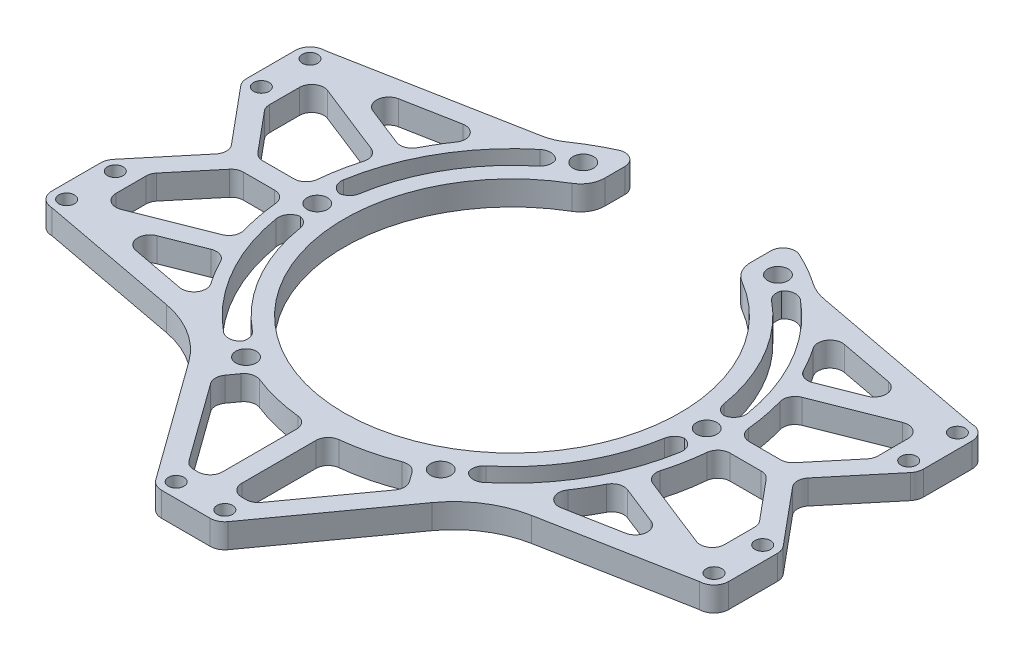
from build123d import *

# Parameters (mm, degrees)
SKETCH_1_R          = 2.1000000000001977
SKETCH_1_R_2        = 2.1000000000001293
SKETCH_1_R_3        = 2.100000000000071
SKETCH_1_R_4        = 2.1000000000002705
SKETCH_1_R_5        = 2.100000000000347
SKETCH_1_R_6        = 2.100000000000003
EXTRUDE_1_DEPTH     = 5
EXTRUDE_START       = -5
SKETCH_2_R          = 3.000000000000006
SKETCH_2_R_2        = 1.5999999999999908
SKETCH_2_R_3        = 2.9999999999999667
SKETCH_2_R_4        = 2.999999999999966
SKETCH_2_R_5        = 2.9999999999999933
SKETCH_2_R_6        = 2.999999999999979
SKETCH_2_R_7        = 2.9999999999999787
EXTRUDE_2_DEPTH     = 5
CUT_EXTRUDE_START   = -5
CUT_EXTRUDE_1_DEPTH = 5
FILLET_1_R          = 5
FILLET_2_R          = 2.5
FILLET_3_R          = 10
SKETCH_4_R          = 1.6000000000000003
SKETCH_4_R_2        = 1.5999999999999985
EXTRUDE_4_DEPTH     = 5
CUT_EXTRUDE_2_DEPTH = 5
FILLET_4_R          = 2.5
CUT_EXTRUDE_3_DEPTH = 5
FILLET_6_R          = 2.5
FILLET_8_R          = 20
FILLET_9_R          = 2.5


with BuildPart() as part:
    # 草图1 → 凸台-拉伸1 (new body)
    with BuildSketch(Plane(origin=(0, 0, 0), x_dir=(1, 0, 0), z_dir=(0, 1, 0))):
        with BuildLine():
            Line((-15.000000000000009, 31.068472765811965), (-15.000000000000009, 41.89570383702844))
            ThreePointArc((-15.000000000000012, 41.89570383702845), (-25.619816548913857, -36.385093101433725), (44.50000000000001, -1.09e-14))
            ThreePointArc((44.50000000000001, 0), (36.385093101433725, 25.619816548913857), (14.999999999999996, 41.89570383702846))
            Line((14.999999999999991, 41.89570383702845), (14.999999999999991, 31.06847276581198))
            ThreePointArc((14.999999999999986, 31.068472765811975), (29.22113960816723, 18.340528890956232), (34.5, 0))
            ThreePointArc((34.5, -8.45e-15), (-18.340528890956218, -29.221139608167242), (-15.000000000000009, 31.068472765811965))
        make_face()
        with Locations(Location((-20.000000000000036, -34.64101615137753, 0), (0, 0, 270))):
            Circle(SKETCH_1_R, mode=Mode.SUBTRACT)
        with Locations(Location((19.999999999999975, -34.64101615137757, 0), (0, 0, 270))):
            Circle(SKETCH_1_R_2, mode=Mode.SUBTRACT)
        with Locations(Location((40.000000000000014, -3.076e-14, 0), (0, 0, 270))):
            Circle(SKETCH_1_R_3, mode=Mode.SUBTRACT)
        with Locations(Location((-40.00000000000001, 2.547e-14, 0), (0, 0, 270))):
            Circle(SKETCH_1_R_4, mode=Mode.SUBTRACT)
        with Locations(Location((-19.999999999999993, 34.64101615137756, 0), (0, 0, 270))):
            Circle(SKETCH_1_R_5, mode=Mode.SUBTRACT)
        with Locations(Location((20.00000000000004, 34.64101615137753, 0), (0, 0, 270))):
            Circle(SKETCH_1_R_6, mode=Mode.SUBTRACT)
    extrude(amount=EXTRUDE_1_DEPTH)

    # 草图2 → 凸台-拉伸2 (add)
    # profile 1 of 16: a face of its own
    with BuildSketch(Plane(origin=(0, 5, 0), x_dir=(1, 0, 0), z_dir=(0, 1, 0)).offset(EXTRUDE_START)):
        with BuildLine():
            ThreePointArc((-34.19429924053646, 28.478059966378474), (-30.724288694148534, 32.191118095502944), (-26.853550976710252, 35.484317662049314))
            Line((-26.853550976710252, 35.484317662049314), (-66.5, 28.000000000000043))
            ThreePointArc((-66.5, 28.000000000000004), (-64.37867965644035, 27.121320343559642), (-63.49999999999999, 24.999999999999996))
            Line((-63.5, 25.000000000000036), (-63.5, 15.000000000000039))
            ThreePointArc((-63.49999999999999, 15), (-65.47914275483694, 12.179033767483535), (-68.80523365666541, 13.080130788783498))
            Line((-68.8052336566654, 13.080130788783507), (-57.91170001964725, 4.086e-14))
            Line((-57.91170001964725, 3.908e-14), (-34.19429924053647, 28.47805996637848))
        make_face()
    # profile 2 of 16: a face of its own
    with BuildSketch(Plane(origin=(0, 5, 0), x_dir=(1, 0, 0), z_dir=(0, 1, 0)).offset(EXTRUDE_START)):
        with BuildLine():
            ThreePointArc((-34.194299240536495, -28.478059966378414), (-44.5, 3.743e-14), (-34.19429924053646, 28.478059966378474))
            Line((-34.19429924053647, 28.47805996637848), (-57.91170001964725, 3.908e-14))
            Line((-57.91170001964725, 4.086e-14), (-34.194299240536495, -28.478059966378417))
        make_face()
    # profile 3 of 16: a face of its own
    with BuildSketch(Plane(origin=(0, 5, 0), x_dir=(1, 0, 0), z_dir=(0, 1, 0)).offset(EXTRUDE_START)):
        with BuildLine():
            Line((-66.5, -27.99999999999994), (-26.85355097671028, -35.48431766204926))
            ThreePointArc((-26.853550976710306, -35.48431766204924), (-30.724288694148584, -32.19111809550287), (-34.194299240536495, -28.478059966378414))
            Line((-34.194299240536495, -28.478059966378417), (-57.91170001964725, 4.086e-14))
            Line((-57.91170001964725, 3.908e-14), (-68.8052336566654, -13.080130788783409))
            ThreePointArc((-68.80523365666531, -13.080130788783476), (-65.47914275483691, -12.17903376748362), (-63.500000000000036, -15.00000000000003))
            ThreePointArc((-63.500000000000036, -15.00000000000003), (-66.5, -17.999999999999996), (-69.49999999999997, -15.00000000000003))
            Line((-69.5, -14.999999999999941), (-69.5, -24.99999999999994))
            ThreePointArc((-69.49999999999997, -25.000000000000032), (-66.5, -22.000000000000068), (-63.500000000000036, -25.000000000000032))
            ThreePointArc((-63.500000000000036, -25.000000000000032), (-64.37867965644038, -27.121320343559653), (-66.5, -27.999999999999996))
        make_face()
    # profile 4 of 16: a face of its own
    with BuildSketch(Plane(origin=(0, 5, 0), x_dir=(1, 0, 0), z_dir=(0, 1, 0)).offset(EXTRUDE_START)):
        with Locations((-66.5, 24.999999999999996)):
            Circle(SKETCH_2_R)
        with Locations(Location((-66.5, 24.999999999999996, 0), (0, 0, 270))):
            Circle(SKETCH_2_R_2, mode=Mode.SUBTRACT)
    # profile 5 of 16: a face of its own
    with BuildSketch(Plane(origin=(0, 5, 0), x_dir=(1, 0, 0), z_dir=(0, 1, 0)).offset(EXTRUDE_START)):
        with BuildLine():
            Line((-63.5, 15.000000000000039), (-63.5, 25.000000000000036))
            ThreePointArc((-63.49999999999999, 24.999999999999996), (-66.5, 21.99999999999999), (-69.5, 24.999999999999996))
            Line((-69.5, 25.000000000000043), (-69.5, 15.000000000000039))
            ThreePointArc((-69.5, 15), (-66.5, 18.000000000000007), (-63.49999999999999, 15))
        make_face()
    # profile 6 of 16: a face of its own
    with BuildSketch(Plane(origin=(0, 5, 0), x_dir=(1, 0, 0), z_dir=(0, 1, 0)).offset(EXTRUDE_START)):
        with Locations((-66.5, 15)):
            Circle(SKETCH_2_R)
        with Locations(Location((-66.5, 15, 0), (0, 0, 270))):
            Circle(SKETCH_2_R_2, mode=Mode.SUBTRACT)
    # profile 7 of 16: a face of its own
    with BuildSketch(Plane(origin=(0, 5, 0), x_dir=(1, 0, 0), z_dir=(0, 1, 0)).offset(EXTRUDE_START)):
        with Locations((-66.5, -15.00000000000003)):
            Circle(SKETCH_2_R_3)
        with Locations(Location((-66.5, -15.00000000000003, 0), (0, 0, 270))):
            Circle(SKETCH_2_R_2, mode=Mode.SUBTRACT)
    # profile 8 of 16: a face of its own
    with BuildSketch(Plane(origin=(0, 5, 0), x_dir=(1, 0, 0), z_dir=(0, 1, 0)).offset(EXTRUDE_START)):
        with Locations((-66.5, -25.000000000000032)):
            Circle(SKETCH_2_R_4)
        with Locations(Location((-66.5, -25.000000000000032, 0), (0, 0, 270))):
            Circle(SKETCH_2_R_2, mode=Mode.SUBTRACT)
    # profile 9 of 16: a face of its own
    with BuildSketch(Plane(origin=(0, 5, 0), x_dir=(1, 0, 0), z_dir=(0, 1, 0)).offset(EXTRUDE_START)):
        with Locations((66.5, 25.000000000000014)):
            Circle(SKETCH_2_R_5)
        with Locations(Location((66.5, 25.000000000000014, 0), (0, 0, 270))):
            Circle(SKETCH_2_R_2, mode=Mode.SUBTRACT)
    # profile 10 of 16: a face of its own
    with BuildSketch(Plane(origin=(0, 5, 0), x_dir=(1, 0, 0), z_dir=(0, 1, 0)).offset(EXTRUDE_START)):
        with BuildLine():
            ThreePointArc((69.5, 25.000000000000014), (66.5, 22.00000000000002), (63.50000000000001, 25.000000000000014))
            Line((63.5, 25.000000000000014), (63.5, 15.000000000000014))
            ThreePointArc((63.50000000000001, 15.000000000000014), (66.5, 18.000000000000007), (69.5, 15.000000000000014))
            Line((69.5, 15.000000000000014), (69.5, 25.000000000000014))
        make_face()
    # profile 11 of 16: a face of its own
    with BuildSketch(Plane(origin=(0, 5, 0), x_dir=(1, 0, 0), z_dir=(0, 1, 0)).offset(EXTRUDE_START)):
        with Locations((66.5, 15.000000000000014)):
            Circle(SKETCH_2_R_5)
        with Locations(Location((66.5, 15.000000000000014, 0), (0, 0, 270))):
            Circle(SKETCH_2_R_2, mode=Mode.SUBTRACT)
    # profile 12 of 16: a face of its own
    with BuildSketch(Plane(origin=(0, 5, 0), x_dir=(1, 0, 0), z_dir=(0, 1, 0)).offset(EXTRUDE_START)):
        with BuildLine():
            Line((63.5, 15.000000000000014), (63.5, 25.000000000000014))
            ThreePointArc((63.50000000000001, 25.000000000000014), (64.37867965644037, 27.121320343559653), (66.5, 28.000000000000007))
            Line((66.5, 28.000000000000014), (26.853550976710267, 35.4843176620493))
            ThreePointArc((26.85355097671027, 35.4843176620493), (30.724288694148555, 32.19111809550293), (34.194299240536466, 28.478059966378463))
            Line((34.19429924053648, 28.478059966378467), (57.91170001964724, 2.309e-14))
            Line((57.91170001964725, 2.132e-14), (68.8052336566654, 13.080130788783482))
            ThreePointArc((68.80523365666538, 13.080130788783494), (65.47914275483693, 12.179033767483567), (63.50000000000001, 15.000000000000014))
        make_face()
    # profile 13 of 16: a face of its own
    with BuildSketch(Plane(origin=(0, 5, 0), x_dir=(1, 0, 0), z_dir=(0, 1, 0)).offset(EXTRUDE_START)):
        with BuildLine():
            Line((34.19429924053649, -28.478059966378428), (57.91170001964725, 2.132e-14))
            Line((57.91170001964724, 2.309e-14), (34.19429924053648, 28.478059966378467))
            ThreePointArc((34.194299240536466, 28.478059966378463), (41.84433244899405, 15.142715803252202), (44.5, 1.222e-14))
            ThreePointArc((44.5, 1.32e-15), (41.844332448994045, -15.14271580325219), (34.19429924053645, -28.478059966378456))
        make_face()
    # profile 14 of 16: a face of its own
    with BuildSketch(Plane(origin=(0, 5, 0), x_dir=(1, 0, 0), z_dir=(0, 1, 0)).offset(EXTRUDE_START)):
        with BuildLine():
            Line((68.8052336566654, -13.080130788783434), (57.91170001964724, 2.309e-14))
            Line((57.91170001964725, 2.132e-14), (34.19429924053649, -28.478059966378428))
            ThreePointArc((34.19429924053645, -28.478059966378456), (30.72428869414853, -32.19111809550292), (26.85355097671026, -35.48431766204928))
            Line((26.853550976710267, -35.48431766204927), (66.5, -27.999999999999964))
            ThreePointArc((66.5, -27.999999999999993), (64.37867965644037, -22.878679656440386), (69.49999999999997, -25.000000000000014))
            Line((69.5, -24.999999999999968), (69.5, -14.999999999999966))
            ThreePointArc((69.49999999999999, -15.000000000000014), (63.679033767483574, -16.020857245163093), (68.80523365666534, -13.080130788783476))
        make_face()
    # profile 15 of 16: a face of its own
    with BuildSketch(Plane(origin=(0, 5, 0), x_dir=(1, 0, 0), z_dir=(0, 1, 0)).offset(EXTRUDE_START)):
        with Locations((66.5, -15.000000000000014)):
            Circle(SKETCH_2_R_6)
        with Locations(Location((66.5, -15.000000000000014, 0), (0, 0, 270))):
            Circle(SKETCH_2_R_2, mode=Mode.SUBTRACT)
    # profile 16 of 16: a face of its own
    with BuildSketch(Plane(origin=(0, 5, 0), x_dir=(1, 0, 0), z_dir=(0, 1, 0)).offset(EXTRUDE_START)):
        with Locations((66.5, -25.000000000000014)):
            Circle(SKETCH_2_R_7)
        with Locations(Location((66.5, -25.000000000000014, 0), (0, 0, 270))):
            Circle(SKETCH_2_R_2, mode=Mode.SUBTRACT)
    extrude(amount=EXTRUDE_2_DEPTH)

    # 草图3 → 切除-拉伸1 (cut)
    with BuildSketch(Plane(origin=(0, 5, 0), x_dir=(1, 0, 0), z_dir=(0, 1, 0)).offset(CUT_EXTRUDE_START)):
        with BuildLine():
            Line((-32.55623047598699, 30.33713660176939), (-58.816200330759, 25.379871549519734))
            Line((-58.816200330759, 25.379871549519734), (-40.61237409836581, 18.19024656496932))
            ThreePointArc((-40.612374098365464, 18.190246564970327), (-37.08500921168835, 24.595773859933555), (-32.55623047598699, 30.337136601769398))
        make_face()
        with BuildLine():
            Line((-42.08173053620753, 14.469898240071085), (-62.5, 22.534120475775534))
            Line((-62.5, 22.534120475775534), (-62.5, 11.759709156062947))
            Line((-62.5, 11.759709156062947), (-54.3718152214307, 2.0000000000000444))
            Line((-54.3718152214307, 2.0000000000000426), (-44.45503346079047, 2.0000000000000426))
            ThreePointArc((-44.45503346079047, 2.0000000000000524), (-43.715300196812954, 8.320007734523207), (-42.081730536207886, 14.469898240070297))
        make_face()
        with BuildLine():
            Line((-62.49999999999999, -22.53412047577548), (-42.081730536207544, -14.469898240071053))
            ThreePointArc((-42.0817305362079, -14.469898240070266), (-43.71530019681296, -8.320007734523157), (-44.455033460790474, -1.999999999999943))
            Line((-44.455033460790474, -1.9999999999999576), (-54.37181522143069, -1.9999999999999576))
            Line((-54.37181522143069, -1.9999999999999567), (-62.5, -11.759709156062945))
            Line((-62.5, -11.759709156062947), (-62.5, -22.53412047577548))
        make_face()
        with BuildLine():
            ThreePointArc((-32.55623047598704, -30.33713660176934), (-37.085009211688394, -24.595773859933498), (-40.612374098365486, -18.19024656497028))
            Line((-40.612374098365834, -18.190246564969293), (-58.81620033075899, -25.379871549519674))
            Line((-58.816200330758974, -25.379871549519688), (-32.556230475987036, -30.337136601769338))
        make_face()
        with BuildLine():
            Line((58.816200330758974, 25.379871549519752), (32.55623047598699, 30.337136601769398))
            ThreePointArc((32.55623047598699, 30.337136601769398), (37.08500921168835, 24.595773859933555), (40.612374098365464, 18.190246564970327))
            Line((40.61237409836581, 18.19024656496933), (58.816200330758996, 25.379871549519745))
        make_face()
        with BuildLine():
            Line((62.5, 11.759709156062963), (62.5, 22.534120475775552))
            Line((62.5, 22.53412047577555), (42.08173053620752, 14.469898240071092))
            ThreePointArc((42.081730536207886, 14.469898240070291), (43.71530019681295, 8.320007734523216), (44.45503346079047, 2.000000000000053))
            Line((44.45503346079048, 2.0000000000000533), (54.371815221430715, 2.000000000000056))
            Line((54.37181522143071, 2.000000000000055), (62.5, 11.759709156062963))
        make_face()
        with BuildLine():
            ThreePointArc((44.455033460790474, -1.9999999999999394), (43.71530019681297, -8.320007734523134), (42.0817305362079, -14.469898240070245))
            Line((42.081730536207544, -14.46989824007104), (62.50000000000001, -22.534120475775463))
            Line((62.50000000000002, -22.534120475775467), (62.5, -11.75970915606293))
            Line((62.5, -11.75970915606293), (54.3718152214307, -1.9999999999999443))
            Line((54.3718152214307, -1.999999999999944), (44.45503346079049, -1.9999999999999467))
        make_face()
        with BuildLine():
            Line((58.816200330758996, -25.379871549519656), (40.612374098365834, -18.190246564969275))
            ThreePointArc((40.61237409836548, -18.190246564970295), (37.08500921168838, -24.595773859933505), (32.55623047598704, -30.33713660176934))
            Line((32.55623047598705, -30.33713660176933), (58.816200330758996, -25.379871549519674))
        make_face()
    extrude(amount=CUT_EXTRUDE_1_DEPTH, mode=Mode.SUBTRACT)

    # 圆角1
    fillet_1_edges = [part.edges().sort_by_distance(p)[0] for p in [
        (14.99999999999999, 2.5, -31.068472765811975),
        (-15.000000000000018, 2.5, -31.06847276581196),
    ]]
    fillet(fillet_1_edges, radius=FILLET_1_R)

    # 圆角2
    fillet_2_edges = [part.edges().sort_by_distance(p)[0] for p in [
        (40.61237409836565, 2.5, -18.19024656496983),
        (32.55623047598699, 2.5, -30.3371366017694),
        (58.81620033075899, 2.5, -25.37987154951975),
        (-40.612374098365656, 2.5, 18.190246564969783),
        (-32.556230475987036, 2.5, 30.337136601769338),
        (-58.81620033075898, 2.5, 25.37987154951968),
        (-44.455033460790474, 2.5, 1.9999999999999512),
        (-42.08173053620772, 2.5, 14.469898240070659),
        (-62.5, 2.5, 22.53412047577548),
        (-62.5, 2.5, 11.759709156062947),
        (-54.37181522143069, 2.5, 1.9999999999999571),
        (-42.081730536207715, 2.5, -14.469898240070691),
        (-44.455033460790474, 2.5, -2.000000000000048),
        (-54.3718152214307, 2.5, -2.0000000000000435),
        (-62.5, 2.5, -11.759709156062947),
        (-62.5, 2.5, -22.534120475775534),
        (32.55623047598705, 2.5, 30.337136601769338),
        (40.61237409836566, 2.5, 18.19024656496979),
        (58.816200330758996, 2.5, 25.379871549519663),
        (14.999999999999993, 2.5, -41.89570383702845),
        (-15.000000000000009, 2.5, -41.89570383702844),
        (42.08173053620773, 2.5, 14.469898240070641),
        (44.45503346079049, 2.5, 1.9999999999999432),
        (54.3718152214307, 2.5, 1.999999999999944),
        (62.5, 2.5, 11.75970915606293),
        (62.500000000000014, 2.5, 22.534120475775467),
        (44.455033460790474, 2.5, -2.0000000000000537),
        (42.0817305362077, 2.5, -14.469898240070693),
        (62.5, 2.5, -22.534120475775552),
        (62.5, 2.5, -11.759709156062963),
        (54.37181522143071, 2.5, -2.0000000000000555),
        (-32.55623047598699, 2.5, -30.337136601769394),
        (-40.61237409836564, 2.5, -18.190246564969826),
        (-58.816200330759, 2.5, -25.379871549519734),
        (-57.91170001964725, 2.5, -3.997e-14),
    ]]
    fillet(fillet_2_edges, radius=FILLET_2_R)

    # 圆角3
    fillet_3_edges = [part.edges().sort_by_distance(p)[0] for p in [
        (-26.853550976710252, 2.5, -35.484317662049314),
        (-26.853550976710295, 2.5, 35.48431766204925),
        (26.853550976710263, 2.5, 35.48431766204928),
        (26.85355097671027, 2.5, -35.4843176620493),
    ]]
    fillet(fillet_3_edges, radius=FILLET_3_R)

    # 草图4 → 凸台-拉伸4 (add)
    with BuildSketch(Plane(origin=(0, 5, 0), x_dir=(1, 0, 0), z_dir=(0, 1, 0)).offset(EXTRUDE_START)):
        with BuildLine():
            ThreePointArc((36.08841225887984, -26.036061542275014), (7.11e-15, -44.50000000000001), (-36.088412258879835, -26.036061542275014))
            Line((-36.08841225887983, -26.03606154227501), (-7.4329266691379665, -65.7552401039736))
            ThreePointArc((-7.432926669137958, -65.7552401039736), (-6.366433256342797, -66.67074149927701), (-4.999999999999993, -67))
            Line((-4.999999999999992, -67), (5.000000000000008, -67))
            ThreePointArc((5.000000000000007, -67), (6.366433256342813, -66.67074149927701), (7.432926669137974, -65.7552401039736))
            Line((7.432926669137981, -65.7552401039736), (36.08841225887983, -26.036061542275))
        make_face()
        with Locations(Location((5.000000000000008, -64, 0), (0, 0, 270))):
            Circle(SKETCH_4_R, mode=Mode.SUBTRACT)
        with Locations(Location((-4.999999999999992, -64, 0), (0, 0, 270))):
            Circle(SKETCH_4_R_2, mode=Mode.SUBTRACT)
    extrude(amount=EXTRUDE_4_DEPTH)

    # 草图5 → 切除-拉伸2 (cut)
    with BuildSketch(Plane(origin=(0, 5, 0), x_dir=(1, 0, 0), z_dir=(0, 1, 0))):
        with BuildLine():
            Line((-20.00784360384346, -41.48855962179132), (-6.652725693256946, -60))
            Line((-6.652725693256946, -60), (-1.9999999999999973, -60))
            Line((-1.9999999999999976, -60), (-2, -39.949968710876384))
            ThreePointArc((-2.000000000000019, -39.94996871087638), (-9.360592752777766, -38.88932119896985), (-16.39764071923745, -36.484481342658654))
            Line((-16.397640719237437, -36.48448134265866), (-20.00784360384346, -41.48855962179132))
        make_face()
        with BuildLine():
            Line((2, -39.949968710876384), (2.0000000000000027, -60))
            Line((2.0000000000000027, -60), (6.652725693256952, -60))
            Line((6.652725693256952, -60), (20.00784360384346, -41.48855962179131))
            Line((20.00784360384346, -41.48855962179131), (16.397640719237437, -36.484481342658654))
            ThreePointArc((16.397640719237437, -36.48448134265866), (9.360592752777718, -38.88932119896987), (1.999999999999969, -39.94996871087638))
        make_face()
    extrude(amount=-CUT_EXTRUDE_2_DEPTH, mode=Mode.SUBTRACT)

    # 圆角4
    fillet_4_edges = [part.edges().sort_by_distance(p)[0] for p in [
        (-16.397640719237444, 2.5, 36.484481342658654),
        (-2.0000000000000098, 2.5, 39.94996871087638),
        (-1.9999999999999973, 2.5, 60),
        (-6.652725693256946, 2.5, 60),
        (-20.00784360384346, 2.5, 41.48855962179132),
        (1.9999999999999847, 2.5, 39.94996871087638),
        (16.397640719237437, 2.5, 36.48448134265866),
        (20.00784360384346, 2.5, 41.48855962179131),
        (6.652725693256952, 2.5, 60),
        (2.0000000000000027, 2.5, 60),
    ]]
    fillet(fillet_4_edges, radius=FILLET_4_R)

    # 草图6 → 切除-拉伸3 (cut)
    with BuildSketch(Plane(origin=(0, 5, 0), x_dir=(1, 0, 0), z_dir=(0, 1, 0))):
        with BuildLine():
            ThreePointArc((-24.418874341178032, 34.29473102256038), (-36.45966949932494, 21.05000000000006), (-41.90954545208058, 4.000000000000021))
            Line((-41.90954545208058, 4.000000000000025), (-37.68832710535186, 4.000000000000025))
            ThreePointArc((-37.68832710535187, 4.000000000000024), (-32.822362803430224, 18.950000000000017), (-22.308265167813673, 30.63904869937237))
            Line((-22.30826516781367, 30.639048699372367), (-24.41887434117803, 34.29473102256038))
        make_face()
        with BuildLine():
            Line((-37.68832710535187, -3.999999999999975), (-41.90954545208058, -3.999999999999975))
            ThreePointArc((-41.90954545208058, -3.999999999999974), (-36.45966949932495, -21.050000000000036), (-24.41887434117804, -34.29473102256037))
            Line((-24.41887434117804, -34.29473102256038), (-22.308265167813683, -30.639048699372353))
            ThreePointArc((-22.308265167813694, -30.639048699372356), (-32.822362803430245, -18.949999999999978), (-37.688327105351874, -3.999999999999965))
        make_face()
        with BuildLine():
            ThreePointArc((41.90954545208058, 3.999999999999981), (36.45966949932495, 21.050000000000033), (24.418874341178054, 34.29473102256036))
            Line((24.41887434117806, 34.29473102256036), (22.3082651678137, 30.639048699372342))
            ThreePointArc((22.30826516781371, 30.639048699372342), (32.82236280343024, 18.94999999999998), (37.68832710535187, 3.9999999999999796))
            Line((37.68832710535187, 3.999999999999979), (41.90954545208058, 3.99999999999998))
        make_face()
        with BuildLine():
            Line((22.308265167813683, -30.63904869937236), (24.41887434117804, -34.29473102256037))
            ThreePointArc((24.418874341178032, -34.29473102256038), (36.45966949932494, -21.050000000000065), (41.90954545208058, -4.000000000000027))
            Line((41.90954545208058, -4.00000000000002), (37.68832710535186, -4.000000000000021))
            ThreePointArc((37.68832710535187, -4.000000000000029), (32.82236280343022, -18.95000000000002), (22.30826516781368, -30.639048699372363))
        make_face()
    extrude(amount=-CUT_EXTRUDE_3_DEPTH, mode=Mode.SUBTRACT)

    # 圆角6
    # the kernel refuses this fillet: 2.5 mm, written as the material it adds along each edge
    with BuildSketch(Plane(origin=(22.30826516781371, 5, -30.639048699372346), x_dir=(0.7916665130065986, 0, 0.6109534615533111), z_dir=(0, -1, 0))) as fillet_6_piece_1:
        with BuildLine():
            CenterArc((2.186463176141713, -2.4990251102372296), FILLET_6_R, 91.60014557493434, 80.74137800847237)
            Line((-0.2912369297728212, -2.165855205907457), (0, 0))
            ThreePointArc((0, 0), (1.058326364952376, -0.0147793288036034), (2.1166527299047466, -6e-17))
        make_face()
    extrude(amount=5)
    with BuildSketch(Plane(origin=(24.418874341178057, 5, -34.29473102256037), x_dir=(0.7938876549677588, 0, 0.608064463103866), z_dir=(0, -1, 0))) as fillet_6_piece_2:
        with BuildLine():
            CenterArc((2.8479811128361265, 2.4984806000664865), FILLET_6_R, 172.55031775560911, 99.44736111195999)
            Line((0.36908334157395617, 2.822619211823023), (0, 0))
            ThreePointArc((0, 0), (1.4675643188543472, -0.02558669488039296), (2.9351286377087082, 1.6e-16))
        make_face()
    extrude(amount=5)
    with BuildSketch(Plane(origin=(37.688327105351874, 5, -3.999999999999983), x_dir=(-0.1332679617319092, 0, -0.9910800423658133), z_dir=(0, -1, 0))) as fillet_6_piece_3:
        with BuildLine():
            CenterArc((2.186463176141719, 2.499025110237228), FILLET_6_R, 187.65847641659332, 80.74137800847251)
            Line((-0.29123692977281423, 2.1658552059074547), (0, 0))
            ThreePointArc((0, 0), (1.0583263649523784, 0.01477932880361051), (2.116652729904759, 6e-17))
        make_face()
    extrude(amount=5)
    with BuildSketch(Plane(origin=(41.90954545208058, 5, -3.9999999999999805), x_dir=(-1, 0, 3.1e-16), z_dir=(0, -1, 0))) as fillet_6_piece_4:
        with BuildLine():
            CenterArc((2.8466474541080364, 2.5), FILLET_6_R, 170.55263888804015, 99.44736111195988)
            ThreePointArc((0.38055540878148886, 2.910353535353532), (0.16490698402555592, 1.4584942219799553), (0, 0))
            Line((0, 0), (2.8466474541080373, 0))
        make_face()
    extrude(amount=5)
    with BuildSketch(Plane(origin=(37.68832710535187, 5, 4.000000000000026), x_dir=(-0.13326796173190308, 0, 0.991080042365814), z_dir=(0, -1, 0))) as fillet_6_piece_5:
        with BuildLine():
            CenterArc((2.186463176141727, -2.499025110237228), FILLET_6_R, 91.6001455749346, 80.74137800847228)
            Line((-0.29123692977280713, -2.165855205907463), (0, 0))
            ThreePointArc((0, 0), (1.0583263649523749, -0.01477932880360351), (2.1166527299047493, -1e-17))
        make_face()
    extrude(amount=5)
    with BuildSketch(Plane(origin=(41.90954545208058, 5, 4.000000000000027), x_dir=(-0.1296554447026115, 0, 0.9915591085048678), z_dir=(0, -1, 0))) as fillet_6_piece_6:
        with BuildLine():
            CenterArc((2.847981112836097, 2.498480600066482), FILLET_6_R, 172.550317755609, 99.44736111196028)
            Line((0.3690833415739292, 2.822619211823025), (0, 0))
            ThreePointArc((0, 0), (1.46756431885434, -0.02558669488039981), (2.9351286377086847, 0))
        make_face()
    extrude(amount=5)
    with BuildSketch(Plane(origin=(22.308265167813687, 5, 30.63904869937236), x_dir=(0.7916665130066, 0, -0.6109534615533091), z_dir=(0, -1, 0))) as fillet_6_piece_7:
        with BuildLine():
            CenterArc((2.186463176141716, 2.499025110237227), FILLET_6_R, 187.65847641659312, 80.74137800847245)
            Line((-0.2912369297728203, 2.1658552059074627), (0, 0))
            ThreePointArc((0, 0), (1.058326364952376, 0.01477932880360078), (2.1166527299047466, -1.8e-16))
        make_face()
    extrude(amount=5)
    with BuildSketch(Plane(origin=(24.41887434117804, 5, 34.29473102256037), x_dir=(-0.49999999999999967, 0, -0.8660254037844388), z_dir=(0, -1, 0))) as fillet_6_piece_8:
        with BuildLine():
            CenterArc((2.846647454108026, 2.499999999999999), FILLET_6_R, 170.55263888803995, 99.44736111195999)
            ThreePointArc((0.38055540878148464, 2.910353535353539), (0.16490698402554546, 1.458494221979956), (0, 0))
            Line((0, 0), (2.846647454108025, 7e-17))
        make_face()
    extrude(amount=5)
    with BuildSketch(Plane(origin=(-24.41887434117804, 5, 34.29473102256037), x_dir=(-0.7938876549677619, 0, -0.6080644631038621), z_dir=(0, -1, 0))) as fillet_6_piece_9:
        with BuildLine():
            CenterArc((2.8479811128361017, 2.4984806000664843), FILLET_6_R, 172.55031775560917, 99.44736111196016)
            Line((0.3690833415739328, 2.822619211823019), (0, 0))
            ThreePointArc((0, 0), (1.4675643188543404, -0.02558669488038912), (2.9351286377086927, -1.1e-16))
        make_face()
    extrude(amount=5)
    with BuildSketch(Plane(origin=(-22.308265167813694, 5, 30.63904869937236), x_dir=(-0.4999999999999973, 0, 0.8660254037844403), z_dir=(0, -1, 0))) as fillet_6_piece_10:
        with BuildLine():
            CenterArc((2.1853484212408687, 2.5000000000000004), FILLET_6_R, 189.25862199152766, 80.7413780084724)
            ThreePointArc((-0.28208199500867825, 2.097772277227716), (-0.12639349968752686, 1.0508557496392812), (0, 0))
            Line((0, 0), (2.1853484212408723, -7e-17))
        make_face()
    extrude(amount=5)
    with BuildSketch(Plane(origin=(-41.90954545208058, 5, 3.9999999999999742), x_dir=(1, 0, 3.1e-16), z_dir=(0, -1, 0))) as fillet_6_piece_11:
        with BuildLine():
            CenterArc((2.846647454108038, 2.5), FILLET_6_R, 170.55263888804015, 99.44736111195982)
            ThreePointArc((0.38055540878149063, 2.910353535353533), (0.1649069840255568, 1.4584942219799535), (0, 0))
            Line((0, 0), (2.8466474541080373, 0))
        make_face()
    extrude(amount=5)
    with BuildSketch(Plane(origin=(-37.688327105351874, 5, 3.99999999999997), x_dir=(-1, 0, 2.44e-15), z_dir=(0, -1, 0))) as fillet_6_piece_12:
        with BuildLine():
            CenterArc((2.1853484212408665, -2.5), FILLET_6_R, 90.00000000000014, 80.74137800847248)
            ThreePointArc((-0.2820819950086835, -2.097772277227728), (-0.126393499687521, -1.050855749639288), (0, 0))
            Line((0, 0), (2.1853484212408603, 0))
        make_face()
    extrude(amount=5)
    with BuildSketch(Plane(origin=(-41.90954545208058, 5, -4.000000000000025), x_dir=(0.1296554447026162, 0, -0.9915591085048671), z_dir=(0, -1, 0))) as fillet_6_piece_13:
        with BuildLine():
            CenterArc((2.84798111283611, 2.498480600066482), FILLET_6_R, 172.5503177556092, 99.44736111195982)
            Line((0.3690833415739416, 2.822619211823016), (0, 0))
            ThreePointArc((0, 0), (1.4675643188543457, -0.02558669488039323), (2.935128637708687, 5e-17))
        make_face()
    extrude(amount=5)
    with BuildSketch(Plane(origin=(-37.68832710535187, 5, -4.000000000000025), x_dir=(0.1332679617318994, 0, -0.9910800423658145), z_dir=(0, -1, 0))) as fillet_6_piece_14:
        with BuildLine():
            CenterArc((2.1864631761417406, -2.4990251102372274), FILLET_6_R, 91.6001455749348, 80.74137800847228)
            Line((-0.29123692977279475, -2.1658552059074716), (0, 0))
            ThreePointArc((0, 0), (1.0583263649523775, -0.0147793288036071), (2.116652729904754, -3e-17))
        make_face()
    extrude(amount=5)
    with BuildSketch(Plane(origin=(-22.308265167813673, 5, -30.63904869937237), x_dir=(-0.7916665130066013, 0, 0.6109534615533075), z_dir=(0, -1, 0))) as fillet_6_piece_15:
        with BuildLine():
            CenterArc((2.186463176141725, 2.49902511023723), FILLET_6_R, 187.65847641659298, 80.74137800847257)
            Line((-0.2912369297728124, 2.1658552059074707), (0, 0))
            ThreePointArc((0, 0), (1.0583263649523773, 0.01477932880360867), (2.1166527299047524, -1.3e-16))
        make_face()
    extrude(amount=5)
    with BuildSketch(Plane(origin=(-24.418874341178032, 5, -34.29473102256038), x_dir=(0.5000000000000017, 0, 0.8660254037844377), z_dir=(0, -1, 0))) as fillet_6_piece_16:
        with BuildLine():
            CenterArc((2.8466474541080196, 2.5000000000000004), FILLET_6_R, 170.55263888804012, 99.44736111195988)
            ThreePointArc((0.3805554087814738, 2.9103535353535332), (0.16490698402554999, 1.4584942219799568), (0, 0))
            Line((0, 0), (2.8466474541080204, -1.1e-16))
        make_face()
    extrude(amount=5)

    # 圆角8
    fillet_8_edges = [part.edges().sort_by_distance(p)[0] for p in [
        (29.65324747999459, 2.5, 34.9558007707736),
        (-29.65324747999461, 2.5, 34.95580077077358),
    ]]
    fillet(fillet_8_edges, radius=FILLET_8_R)

    # 圆角9
    fillet_9_edges = [part.edges().sort_by_distance(p)[0] for p in [
        (57.91170001964724, 2.5, -2.22e-14),
    ]]
    fillet(fillet_9_edges, radius=FILLET_9_R)


solid = part.part
